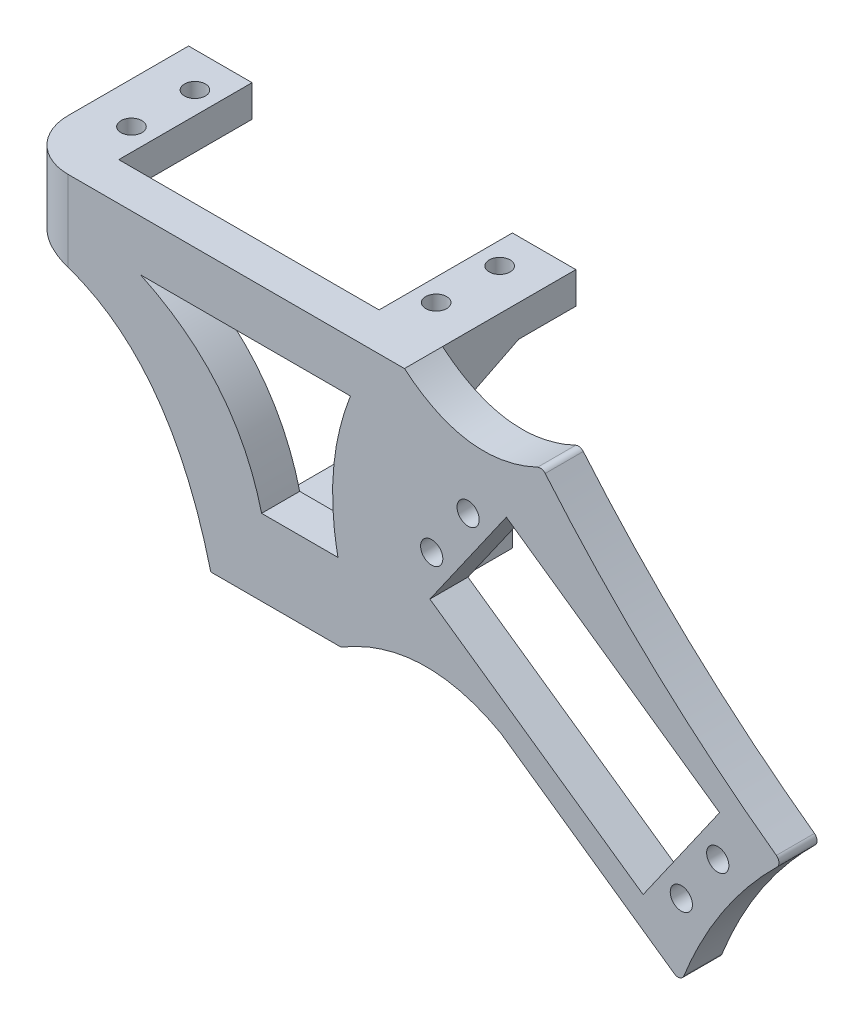
from build123d import *

# Parameters (mm, degrees)
SKETCH1_W               = 130
SKETCH1_H               = 70
BOSS_EXTRUDE1_DEPTH     = 27
SKETCH2_R               = 1.75
CUT_EXTRUDE1_DEPTH      = 79.606615498
CUT_EXTRUDE2_START      = -21
CUT_EXTRUDE2_OUTLINE_R  = 1.75
CUT_EXTRUDE2_DEPTH      = 21
CUT_EXTRUDE3_DEPTH      = 100.813505607
CUT_EXTRUDE3_DEPTH_BACK = 100.813505607
SKETCH5_R               = 1.65
SKETCH5_R_2             = 2.2
CUT_EXTRUDE4_DEPTH      = 94.44983135
CUT_EXTRUDE5_DEPTH      = 2
FILLET1_R               = 8


# Read off the part's stored shape, not the designer's step: Cut-Extrude2
with BuildPart() as part:
    # Sketch1 → Boss-Extrude1 (new body)
    with BuildSketch(Plane.XY):
        Rectangle(SKETCH1_W, SKETCH1_H)
    extrude(amount=BOSS_EXTRUDE1_DEPTH)

    # Sketch2 → Cut-Extrude1 (cut, through all)
    with BuildSketch(Plane(origin=(0, 0, 0), x_dir=(-1, 0, 0), z_dir=(0, 0, -1))):
        with BuildLine():
            add(Edge.make_bspline(
                [(14, -8), (12.412656523, -7.055676593), (9.829799179, -5.770272176), (6.165512557, -4.606713552), (3.277012022, -4.062959942), (0.564036018, -3.901535266), (-2.216713416, -4.070795733), (-6.222645376, -4.825329711), (-9.261142271, -6.092866446), (-11.207024466, -7.170674217)],
                knots=[0, 0, 0, 0, 0.208912226, 0.324847868, 0.433763925, 0.540513306, 0.631348632, 0.748251472, 1, 1, 1, 1], degree=3))
            Line((-11.207024466, -7.170674217), (-38.514642112, -26.291673943))
            ThreePointArc((-38.514642112, -26.291673943), (-39.375842934, -26.43026519), (-40.018197727, -25.840134095))
            add(Edge.make_bspline(
                [(-54.693432206, -3.639104104), (-54.000239817, -4.322176148), (-52.771901008, -5.586727304), (-51.191675368, -7.351333396), (-50.009383391, -8.761398854), (-48.960444962, -10.077193603), (-48.021966464, -11.318023658), (-46.929298413, -12.844883167), (-45.807480175, -14.514983511), (-44.698429074, -16.303801358), (-43.610061024, -18.190212069), (-42.623413939, -20.039778385), (-41.346245965, -22.653074903), (-40.526939035, -24.553048699), (-40.018197727, -25.840134095)],
                knots=[0, 0, 0, 0, 0.108901726, 0.197234234, 0.265009817, 0.314795349, 0.38552882, 0.439078637, 0.524888988, 0.610617011, 0.674554255, 0.76857808, 0.845134678, 1, 1, 1, 1], degree=3))
            ThreePointArc((-54.693432206, -3.639104104), (-54.988709395, -2.851622056), (-54.578672675, -2.11732887))
            add(Edge.make_bspline(
                [(-54.578672675, -2.11732887), (-52.904706158, -0.903188565), (-50.213471625, 1.1109576), (-46.620959917, 3.939887731), (-43.553861019, 6.447777415), (-40.876153765, 8.726535519), (-38.155516815, 11.122837462), (-35.877293384, 13.195237532), (-33.560975223, 15.373252509), (-31.589578869, 17.278645179), (-29.116728404, 19.73422006), (-26.589609741, 22.339446363), (-24.018869132, 25.098935859), (-21.319274087, 28.088310862), (-19.398072944, 30.309569394), (-18.167896158, 31.772237731)],
                knots=[0, 0, 0, 0, 0.124410707, 0.202203721, 0.275081929, 0.362753741, 0.41371947, 0.493193443, 0.548026308, 0.604997703, 0.658133266, 0.7576823, 0.823332152, 0.885019477, 1, 1, 1, 1], degree=3))
            ThreePointArc((-18.167896158, 31.772237731), (-17.616183173, 32.105495699), (-16.975732581, 32.032893158))
            add(Edge.make_bspline(
                [(-16.975732581, 32.032893158), (-16.07038591, 31.605615141), (-14.190483196, 30.84692344), (-11.432318602, 30.167487646), (-9.106305345, 29.956953669), (-7.247829325, 30.005761544), (-5.636150486, 30.202914826), (-4.104137993, 30.549932261), (-2.615674759, 31.028158171), (-1.384323931, 31.538183258), (-0.269738408, 32.090279064), (0.652828442, 32.606390757), (2.122584172, 33.524520801), (3.221931153, 34.350377975), (4, 35)],
                knots=[0, 0, 0, 0, 0.133264553, 0.269301018, 0.376459272, 0.443117385, 0.516465554, 0.592229051, 0.651846415, 0.724397358, 0.769397209, 0.81736137, 0.865051933, 1, 1, 1, 1], degree=3))
            Line((4, 35), (-65, 35))
            Line((-65, 35), (-65, -35))
            Line((-65, -35), (65, -35))
            Line((65, -35), (65, 23.8))
            add(Edge.make_bspline(
                [(34.5, -8), (35.043061412, -5.842802386), (36.023743001, -2.466653125), (37.707498645, 2.038626647), (39.250500058, 5.470378664), (40.910531254, 8.537294569), (42.727183517, 11.357919306), (44.656417758, 13.852387174), (46.976953716, 16.316608014), (49.498712998, 18.458196173), (52.259790918, 20.25141053), (55.197814462, 21.706116383), (58.058541869, 22.702999613), (61.418054191, 23.471660912), (63.619738318, 23.724829372), (65, 23.8)],
                knots=[0, 0, 0, 0, 0.140280558, 0.221445335, 0.303096868, 0.377342059, 0.441125059, 0.51446902, 0.575837651, 0.65428395, 0.722450724, 0.782920233, 0.860623982, 0.912822204, 1, 1, 1, 1], degree=3))
            Line((34.5, -8), (14, -8))
        make_face()
        Polygon((-33.591106657, -17.961078948), (-0.005872841, 5.555554943), (-12.050978004, 22.757747873), (-45.63621182, -0.758886018), align=None)
        with Locations((-45.348573575, -7.271739788)):
            Circle(SKETCH2_R)
        with Locations((-39.612809212, -15.463260231)):
            Circle(SKETCH2_R)
        with Locations((-0.293511086, 12.068408714)):
            Circle(SKETCH2_R)
        with Locations((-6.029275449, 20.259929156)):
            Circle(SKETCH2_R)
        with BuildLine():
            add(Edge.make_bspline(
                [(45.563538233, 27), (43.389199875, 25.977901541), (39.886025201, 23.963630926), (36.000760835, 20.736612979), (33.23904056, 17.802043425), (30.912235406, 14.67678007), (28.353826133, 10.034151363), (27.08111073, 6.339222762), (26.5, 4)],
                knots=[0, 0, 0, 0, 0.232992533, 0.389790585, 0.487746096, 0.623149509, 0.766347799, 1, 1, 1, 1], degree=3))
            Line((26.5, 4), (14.472989206, 4))
            add(Edge.make_bspline(
                [(12.50850871, 27), (13.090671786, 25.509563557), (13.866518923, 23.147635977), (14.582812232, 20.03122413), (15.015130042, 17.446221031), (15.274561682, 14.843030618), (15.347261596, 12.133178471), (15.216584761, 8.550820577), (14.849227023, 5.860770346), (14.472989206, 4)],
                knots=[0, 0, 0, 0, 0.205082191, 0.318017932, 0.409516878, 0.540841365, 0.652931948, 0.756700096, 1, 1, 1, 1], degree=3))
            Line((12.50850871, 27), (45.563538233, 27))
        make_face()
    extrude(amount=-CUT_EXTRUDE1_DEPTH, mode=Mode.SUBTRACT)

    # Cut-Extrude2 outline → Cut-Extrude2 (cut)
    with BuildSketch(Plane(origin=(0, 0, 0), x_dir=(-1, 0, 0), z_dir=(0, 0, -1)).offset(CUT_EXTRUDE2_START)):
        with BuildLine():
            Line((7, 24), (4, 24))
            Line((4, 24), (4, 35))
            add(Edge.make_bspline(
                [(4, 35), (3.221931153, 34.350377975), (2.122584172, 33.524520801), (0.652828442, 32.606390757), (-0.269738408, 32.090279064), (-1.384323931, 31.538183258), (-2.615674759, 31.028158171), (-4.104137993, 30.549932261), (-5.636150486, 30.202914826), (-7.247829325, 30.005761544), (-9.106305345, 29.956953669), (-11.432318602, 30.167487646), (-14.190483196, 30.84692344), (-16.07038591, 31.605615141), (-16.975732581, 32.032893158)],
                knots=[2.0985e-05, 2.0985e-05, 2.0985e-05, 2.0985e-05, 0.134969052, 0.182659615, 0.230623776, 0.275623627, 0.34817457, 0.407791934, 0.483555431, 0.5569036, 0.623561713, 0.730719967, 0.866756432, 1.000020985, 1.000020985, 1.000020985, 1.000020985], degree=3))
            ThreePointArc((-16.975732581, 32.032893158), (-17.616183174, 32.105495699), (-18.167896158, 31.772237731))
            add(Edge.make_bspline(
                [(-54.578672675, -2.11732887), (-52.904706158, -0.903188565), (-50.213471625, 1.1109576), (-46.620959917, 3.939887731), (-43.553861019, 6.447777415), (-40.876153765, 8.726535519), (-38.155516815, 11.122837462), (-35.877293384, 13.195237532), (-33.560975223, 15.373252509), (-31.589578869, 17.278645179), (-29.116728404, 19.73422006), (-26.589609741, 22.339446363), (-24.018869132, 25.098935859), (-21.319274087, 28.088310862), (-19.398072944, 30.309569394), (-18.167896158, 31.772237731)],
                knots=[0, 0, 0, 0, 0.124410707, 0.202203721, 0.275081929, 0.362753741, 0.41371947, 0.493193443, 0.548026308, 0.604997703, 0.658133266, 0.7576823, 0.823332152, 0.885019477, 1, 1, 1, 1], degree=3))
            ThreePointArc((-54.578672675, -2.11732887), (-54.988709395, -2.851622056), (-54.693432206, -3.639104104))
            add(Edge.make_bspline(
                [(-54.693432206, -3.639104104), (-54.000239817, -4.322176148), (-52.771901008, -5.586727304), (-51.191675368, -7.351333396), (-50.009383391, -8.761398854), (-48.960444962, -10.077193603), (-48.021966464, -11.318023658), (-46.929298413, -12.844883167), (-45.807480175, -14.514983511), (-44.698429074, -16.303801358), (-43.610061024, -18.190212069), (-42.623413939, -20.039778385), (-41.346245965, -22.653074903), (-40.526939035, -24.553048699), (-40.018197727, -25.840134095)],
                knots=[0, 0, 0, 0, 0.108901726, 0.197234234, 0.265009817, 0.314795349, 0.38552882, 0.439078637, 0.524888988, 0.610617011, 0.674554255, 0.76857808, 0.845134678, 1, 1, 1, 1], degree=3))
            ThreePointArc((-40.018197727, -25.840134095), (-39.375842934, -26.43026519), (-38.514642112, -26.291673943))
            Line((-38.514642112, -26.291673943), (-11.207024466, -7.170674217))
            add(Edge.make_bspline(
                [(14, -8), (12.412656523, -7.055676593), (9.829799179, -5.770272176), (6.165512557, -4.606713552), (3.277012022, -4.062959942), (0.564036018, -3.901535266), (-2.216713416, -4.070795733), (-6.222645376, -4.825329711), (-9.261142271, -6.092866446), (-11.207024466, -7.170674217)],
                knots=[0, 0, 0, 0, 0.208912226, 0.324847868, 0.433763925, 0.540513306, 0.631348632, 0.748251472, 1, 1, 1, 1], degree=3))
            Line((14, -8), (14, 0.3))
            Line((14, 0.3), (34.5, 0.3))
            Line((34.5, 0.3), (34.5, -8))
            add(Edge.make_bspline(
                [(34.5, -8), (35.043061412, -5.842802386), (36.023743001, -2.466653125), (37.707498645, 2.038626647), (39.250500058, 5.470378664), (40.910531254, 8.537294569), (42.727183517, 11.357919306), (44.656417758, 13.852387174), (46.976953716, 16.316608014), (49.498712998, 18.458196173), (52.259790918, 20.25141053), (55.197814462, 21.706116383), (58.058541869, 22.702999613), (61.418054191, 23.471660912), (63.619738318, 23.724829372), (65, 23.8)],
                knots=[0, 0, 0, 0, 0.140280558, 0.221445335, 0.303096868, 0.377342059, 0.441125059, 0.51446902, 0.575837651, 0.65428395, 0.722450724, 0.782920233, 0.860623982, 0.912822204, 1, 1, 1, 1], degree=3))
            Line((65, 23.8), (65, 24))
            Line((65, 24), (62, 24))
            Line((62, 24), (62, 30))
            Line((62, 30), (55, 30))
            Line((55, 30), (55, 35))
            Line((55, 35), (14, 35))
            Line((14, 35), (14, 30))
            Line((14, 30), (7, 30))
            Line((7, 30), (7, 24))
        make_face()
        with Locations((-39.612809212, -15.463260231)):
            Circle(CUT_EXTRUDE2_OUTLINE_R, mode=Mode.SUBTRACT)
        with Locations((-45.348573575, -7.271739788)):
            Circle(CUT_EXTRUDE2_OUTLINE_R, mode=Mode.SUBTRACT)
        Polygon((-0.005872841, 5.555554943), (-33.591106657, -17.961078948), (-45.63621182, -0.758886018), (-12.050978004, 22.757747873), align=None, mode=Mode.SUBTRACT)
        with Locations((-0.293511086, 12.068408714)):
            Circle(CUT_EXTRUDE2_OUTLINE_R, mode=Mode.SUBTRACT)
        with Locations((-6.029275449, 20.259929156)):
            Circle(CUT_EXTRUDE2_OUTLINE_R, mode=Mode.SUBTRACT)
        with BuildLine():
            Line((12.50850871, 27), (45.563538233, 27))
            add(Edge.make_bspline(
                [(45.563538233, 27), (43.389199875, 25.977901541), (39.886025201, 23.963630926), (36.000760835, 20.736612979), (33.23904056, 17.802043425), (30.912235406, 14.67678007), (28.353826133, 10.034151363), (27.08111073, 6.339222762), (26.5, 4)],
                knots=[0, 0, 0, 0, 0.232992533, 0.389790585, 0.487746096, 0.623149509, 0.766347799, 1, 1, 1, 1], degree=3))
            Line((26.5, 4), (14.472989206, 4))
            add(Edge.make_bspline(
                [(12.50850871, 27), (13.090671786, 25.509563557), (13.866518923, 23.147635977), (14.582812232, 20.03122413), (15.015130042, 17.446221031), (15.274561682, 14.843030618), (15.347261596, 12.133178471), (15.216584761, 8.550820577), (14.849227023, 5.860770346), (14.472989206, 4)],
                knots=[0, 0, 0, 0, 0.205082191, 0.318017932, 0.409516878, 0.540841365, 0.652931948, 0.756700096, 1, 1, 1, 1], degree=3))
        make_face(mode=Mode.SUBTRACT)
    extrude(amount=CUT_EXTRUDE2_DEPTH, mode=Mode.SUBTRACT)

    # Sketch4 → Cut-Extrude3 (cut, two sides: drawn at the far end of the back side and taken through both)
    with BuildSketch(Plane.ZY.offset(34.5).offset(-CUT_EXTRUDE3_DEPTH_BACK)):
        Polygon((0, 24), (0, 30), (9, 30), (21, 24), align=None)
        Polygon((0, 0.3), (0, -3), (17.7, -3), (21, 0.3), align=None)
    extrude(amount=CUT_EXTRUDE3_DEPTH + CUT_EXTRUDE3_DEPTH_BACK, mode=Mode.SUBTRACT)

    # Sketch5 → Cut-Extrude4 (cut, through all)
    with BuildSketch(Plane(origin=(0, 35, 0), x_dir=(1, 0, 0), z_dir=(0, 1, 0))):
        with Locations(Location((-10.5, -5.5, 0), (0, 0, 270))):
            Circle(SKETCH5_R)
        with Locations(Location((-10.5, -15.5, 0), (0, 0, 270))):
            Circle(SKETCH5_R)
        with Locations(Location((-58.5, -15.5, 0), (0, 0, 270))):
            Circle(SKETCH5_R)
        with Locations(Location((-58.5, -5.5, 0), (0, 0, 270))):
            Circle(SKETCH5_R)
        with Locations(Location((-24.25, -10.5, 0), (0, 0, 90))):
            Circle(SKETCH5_R_2)
    extrude(amount=-CUT_EXTRUDE4_DEPTH, mode=Mode.SUBTRACT)

    # Sketch6 → Cut-Extrude5 (cut)
    with BuildSketch(Plane(origin=(0, -3, 0), x_dir=(1, 0, 0), z_dir=(0, 1, 0))):
        Polygon((-19.977608008, -10.5), (-22.113804004, -6.8), (-26.386195996, -6.8), (-28.522391992, -10.5), (-26.386195996, -14.2), (-22.113804004, -14.2), align=None)
    extrude(amount=-CUT_EXTRUDE5_DEPTH, mode=Mode.SUBTRACT)

    # Fillet1
    fillet1_edges = [part.edges().sort_by_distance(p)[0] for p in [
        (-65, 29.4, 27),
    ]]
    fillet(fillet1_edges, radius=FILLET1_R)


solid = part.part
